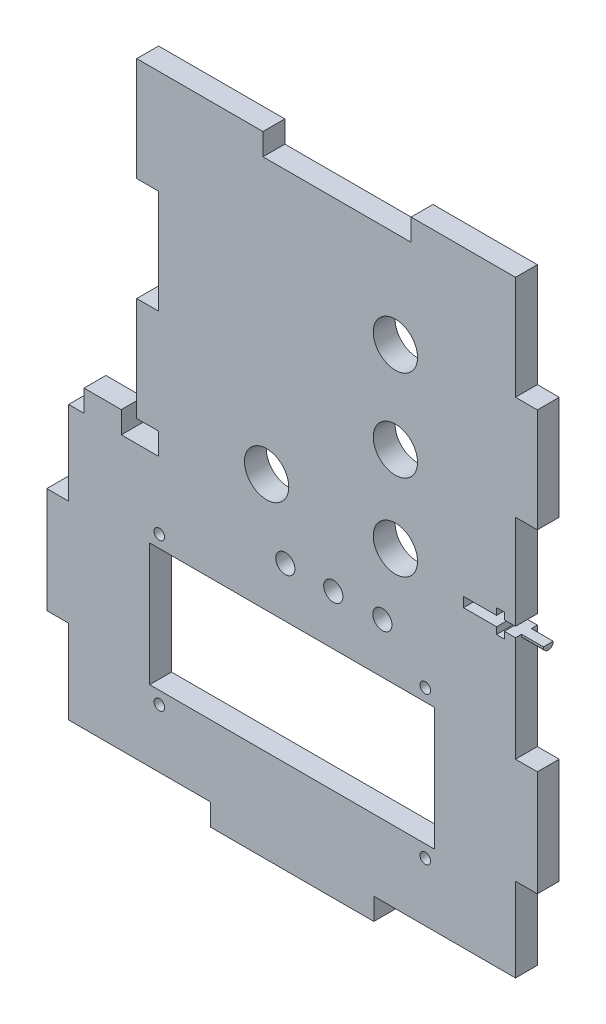
from build123d import *

# Parameters (mm, degrees)
SKETCH1_W           = 129.9464
SKETCH1_H           = 83.9724
BOSS_EXTRUDE1_DEPTH = 5.7912
SKETCH7_W           = 106.1212
SKETCH7_H           = 82.55
BOSS_EXTRUDE2_DEPTH = 5.7912
SKETCH12_W          = 5.7912
SKETCH12_H          = 27.516666666
CUT_EXTRUDE9_DEPTH  = 141.585631649
SKETCH15_W          = 35.373733334
SKETCH15_H          = 5.7912
CUT_EXTRUDE12_DEPTH = 141.585631649
SKETCH18_R          = 1.397
SKETCH18_W          = 75.438
SKETCH18_H          = 32.512
CUT_EXTRUDE15_DEPTH = 141.585631649
SKETCH19_W          = 19.558
SKETCH19_H          = 2.6035
CUT_EXTRUDE16_DEPTH = 141.585631649
SKETCH20_W          = 2.0828
SKETCH20_H          = 6.1722
CUT_EXTRUDE17_DEPTH = 141.585631649
CAVITY1_START       = 59.182
CAVITY1_OUTLINE_W   = 27.9908
CAVITY1_OUTLINE_H   = 5.7912
CAVITY1_OUTLINE_W_2 = 25.036356667
CAVITY1_OUTLINE_W_3 = 27.516666667
CAVITY1_DEPTH       = 5.7912
CAVITY1_START_2     = -64.9732
CAVITY1_2_OUTLINE_W = 27.9908
CAVITY1_2_OUTLINE_H = 5.7912
CAVITY1_2_DEPTH     = 5.7912
CAVITY1_START_3     = -59.182
CAVITY1_3_OUTLINE_W = 5.7912
CAVITY1_3_OUTLINE_H = 5.7912
CAVITY1_3_DEPTH     = 37.524266667
CAVITY1_START_4     = 21.657733333
CAVITY1_4_OUTLINE_W = 5.7912
CAVITY1_4_OUTLINE_H = 5.7912
CAVITY1_4_DEPTH     = 37.524266667
CAVITY1_START_5     = -45.228933333
CAVITY1_5_OUTLINE_W = 5.7912
CAVITY1_5_OUTLINE_H = 5.7912
CAVITY1_5_DEPTH     = 9.872133333
CAVITY1_6_OUTLINE_W = 5.7912
CAVITY1_6_OUTLINE_H = 5.7912
CAVITY1_6_DEPTH     = 4.080933333
CAVITY1_START_6     = -7.704666667
CAVITY1_7_OUTLINE_W = 5.7912
CAVITY1_7_OUTLINE_H = 5.7912
CAVITY1_7_DEPTH     = 39.234533334
SKETCH21_R          = 2.54
CUT_EXTRUDE18_DEPTH = 141.585631649
SKETCH22_R          = 5.8674
SKETCH22_W          = 10.922
SKETCH22_H          = 12.7
CUT_EXTRUDE19_DEPTH = 141.585631649


# Read off the part's stored shape, not the designer's step: Cavity1
with BuildPart() as part:
    # Sketch1 → Boss-Extrude1 (new body)
    with BuildSketch(Plane.XY):
        Rectangle(SKETCH1_W, SKETCH1_H)
    extrude(amount=BOSS_EXTRUDE1_DEPTH)

    # Sketch7 → Boss-Extrude2 (add)
    with BuildSketch(Plane.XY.offset(5.7912)):
        with Locations((11.9126, 83.2612)):
            Rectangle(SKETCH7_W, SKETCH7_H)
    extrude(amount=-BOSS_EXTRUDE2_DEPTH)

    # Sketch12 → Cut-Extrude9 (cut, through all)
    with BuildSketch(Plane.XY.offset(5.7912)):
        with Locations((-38.2524, 83.2612)):
            Rectangle(SKETCH12_W, SKETCH12_H)
    extrude(amount=-CUT_EXTRUDE9_DEPTH, mode=Mode.SUBTRACT)

    # Sketch15 → Cut-Extrude12 (cut, through all)
    with BuildSketch(Plane.XY.offset(5.7912)):
        with Locations((11.9126, 121.6406)):
            Rectangle(SKETCH15_W, SKETCH15_H)
    extrude(amount=-CUT_EXTRUDE12_DEPTH, mode=Mode.SUBTRACT)

    # Sketch18 → Cut-Extrude15 (cut, through all)
    with BuildSketch(Plane.XY.offset(5.7912)):
        with Locations((-35.183452425, 18.449919855)):
            Circle(SKETCH18_R)
        with Locations((35.276147575, 18.449919855)):
            Circle(SKETCH18_R)
        with Locations(Location((35.276147575, -20.666080145, 0), (0, 0, 180))):
            Circle(SKETCH18_R)
        with Locations(Location((-35.183452425, -20.666080145, 0), (0, 0, 180))):
            Circle(SKETCH18_R)
        with Locations((-0.004452425, -1.108080145)):
            Rectangle(SKETCH18_W, SKETCH18_H)
    extrude(amount=-CUT_EXTRUDE15_DEPTH, mode=Mode.SUBTRACT)

    # Sketch19 → Cut-Extrude16 (cut, through all)
    with BuildSketch(Plane.XY.offset(5.7912)):
        with Locations((55.1942, 43.16476)):
            Rectangle(SKETCH19_W, SKETCH19_H)
    extrude(amount=-CUT_EXTRUDE16_DEPTH, mode=Mode.SUBTRACT)

    # Sketch20 → Cut-Extrude17 (cut, through all)
    with BuildSketch(Plane.XY.offset(5.7912)):
        with Locations((55.1942, 43.16476)):
            Rectangle(SKETCH20_W, SKETCH20_H)
    extrude(amount=-CUT_EXTRUDE17_DEPTH, mode=Mode.SUBTRACT)

    # Cavity1 outline → Cavity1 (cut)
    with BuildSketch(Plane.YZ.offset(CAVITY1_START)):
        with Locations((-27.9908, 2.8956)):
            Rectangle(CAVITY1_OUTLINE_W, CAVITY1_OUTLINE_H)
        with BuildLine():
            Line((13.9954, 5.7912), (13.9954, 0))
            Line((13.9954, 0), (41.86301, 0))
            Line((41.86301, 0), (41.86301, 1.598840513))
            ThreePointArc((41.86301, 1.598840513), (40.447383333, 2.8956), (41.86301, 4.192359487))
            Line((41.86301, 4.192359487), (41.86301, 5.7912))
            Line((41.86301, 5.7912), (13.9954, 5.7912))
        make_face()
        with Locations((56.984688334, 2.8956)):
            Rectangle(CAVITY1_OUTLINE_W_2, CAVITY1_OUTLINE_H)
        with Locations((110.777866667, 2.8956)):
            Rectangle(CAVITY1_OUTLINE_W_3, CAVITY1_OUTLINE_H)
    extrude(amount=CAVITY1_DEPTH, mode=Mode.SUBTRACT)

    # Cavity1 2 outline → Cavity1 2 (cut)
    with BuildSketch(Plane.YZ.offset(CAVITY1_START_2)):
        with Locations((-27.9908, 2.8956)):
            Rectangle(CAVITY1_2_OUTLINE_W, CAVITY1_2_OUTLINE_H)
        with Locations((27.9908, 2.8956)):
            Rectangle(CAVITY1_2_OUTLINE_W, CAVITY1_2_OUTLINE_H)
    extrude(amount=CAVITY1_2_DEPTH, mode=Mode.SUBTRACT)

    # Cavity1 3 outline → Cavity1 3 (cut)
    with BuildSketch(Plane.YZ.offset(CAVITY1_START_3)):
        with Locations((-39.0906, 2.8956)):
            Rectangle(CAVITY1_3_OUTLINE_W, CAVITY1_3_OUTLINE_H)
    extrude(amount=CAVITY1_3_DEPTH, mode=Mode.SUBTRACT)

    # Cavity1 4 outline → Cavity1 4 (cut)
    with BuildSketch(Plane.YZ.offset(CAVITY1_START_4)):
        with Locations((-39.0906, 2.8956)):
            Rectangle(CAVITY1_4_OUTLINE_W, CAVITY1_4_OUTLINE_H)
    extrude(amount=CAVITY1_4_DEPTH, mode=Mode.SUBTRACT)

    # Cavity1 5 outline → Cavity1 5 (cut)
    with BuildSketch(Plane.YZ.offset(CAVITY1_START_5)):
        with Locations((39.0906, 2.8956)):
            Rectangle(CAVITY1_5_OUTLINE_W, CAVITY1_5_OUTLINE_H)
    extrude(amount=CAVITY1_5_DEPTH, mode=Mode.SUBTRACT)

    # Cavity1 6 outline → Cavity1 6 (cut)
    with BuildSketch(Plane.YZ.offset(CAVITY1_START_3)):
        with Locations((39.0906, 2.8956)):
            Rectangle(CAVITY1_6_OUTLINE_W, CAVITY1_6_OUTLINE_H)
    extrude(amount=CAVITY1_6_DEPTH, mode=Mode.SUBTRACT)

    # Cavity1 7 outline → Cavity1 7 (cut)
    with BuildSketch(Plane.YZ.offset(CAVITY1_START_6)):
        with Locations((121.6406, 2.8956)):
            Rectangle(CAVITY1_7_OUTLINE_W, CAVITY1_7_OUTLINE_H)
    extrude(amount=CAVITY1_7_DEPTH, mode=Mode.SUBTRACT)

    # Sketch21 → Cut-Extrude18 (cut, through all)
    with BuildSketch(Plane.XY.offset(5.7912)):
        with Locations((23.919169713, 28.405342819)):
            Circle(SKETCH21_R)
        with Locations((10.918159713, 28.405342819)):
            Circle(SKETCH21_R)
        with Locations((-1.787317277, 28.405342819)):
            Circle(SKETCH21_R)
    extrude(amount=-CUT_EXTRUDE18_DEPTH, mode=Mode.SUBTRACT)

    # Sketch22 → Cut-Extrude19 (cut, through all)
    with BuildSketch(Plane.XY.offset(5.7912)):
        with Locations((27.368980229, 46.405060213)):
            Circle(SKETCH22_R)
        with Locations((-6.74229364, 46.405060213)):
            Circle(SKETCH22_R)
        with Locations((27.368980229, 69.094682683)):
            Circle(SKETCH22_R)
        with Locations((27.368980229, 93.171449402)):
            Circle(SKETCH22_R)
        with Locations((995.334727121, -604.282322998)):
            Rectangle(SKETCH22_W, SKETCH22_H)
        with Locations((995.334727121, -676.824722998)):
            Rectangle(SKETCH22_W, SKETCH22_H)
        with Locations((995.334727121, -628.971122998)):
            Rectangle(SKETCH22_W, SKETCH22_H)
        with Locations((995.334727121, -653.117356371)):
            Rectangle(SKETCH22_W, SKETCH22_H)
    extrude(amount=-CUT_EXTRUDE19_DEPTH, mode=Mode.SUBTRACT)


solid = part.part
